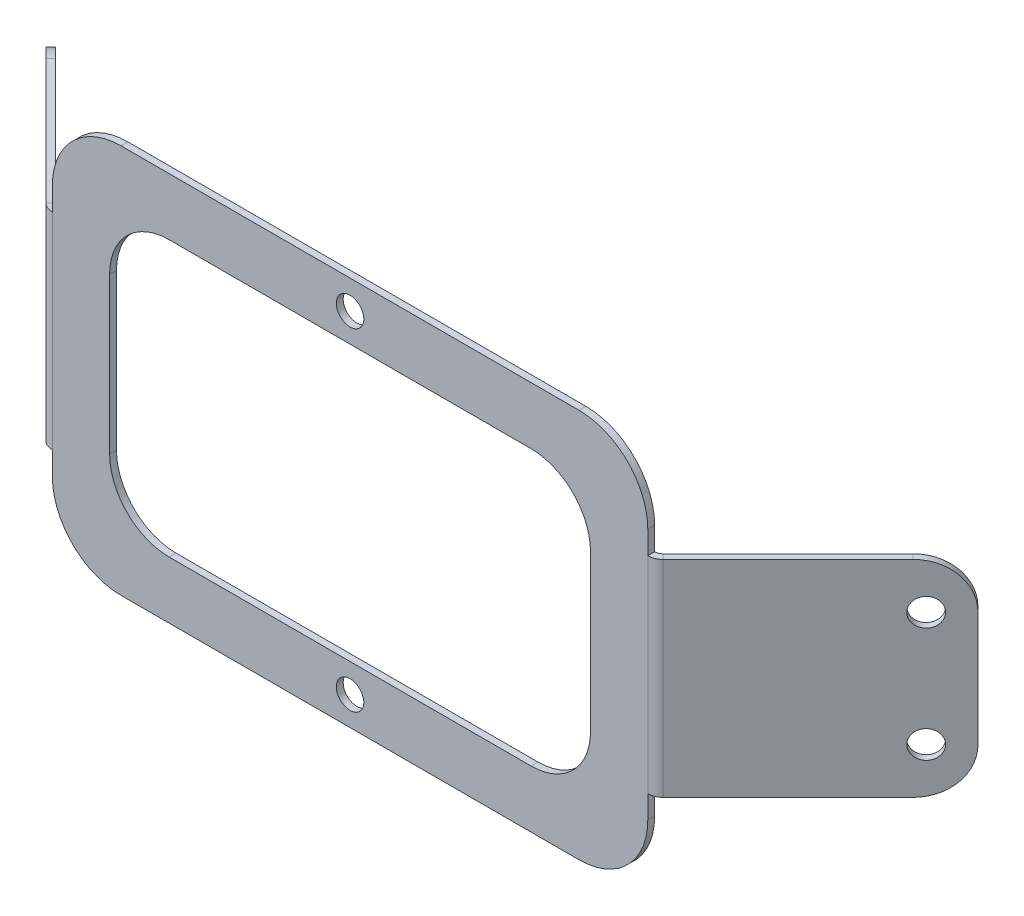
from build123d import *

# Parameters (mm, degrees)
BASE_FLANGE1_DEPTH          = 1.5
SM_EDGE_FLANGE_1_DEPTH      = 45
SM_EDGE_FLANGE_1_BEND_DEPTH = 45
SKETCH12_R                  = 3
CUT_EXTRUDE1_DEPTH          = 10
FILLET1_R                   = 10
SKETCH13_R                  = 3
CUT_EXTRUDE2_DEPTH          = 10
SKETCH14_R                  = 3
CUT_EXTRUDE3_DEPTH          = 10


# Sheet-metal steps are written as plain solids
with BuildPart() as part:
    # Sketch1 → Base-Flange1 (new body)
    with BuildSketch(Plane.XY):
        with BuildLine():
            Line((15, 0), (115, 0))
            ThreePointArc((115, 0), (125.606601718, 4.393398282), (130, 15))
            Line((130, 15), (130, 70))
            ThreePointArc((130, 70), (125.606601718, 80.606601718), (115, 85))
            Line((115, 85), (15, 85))
            ThreePointArc((15, 85), (4.393398282, 80.606601718), (0, 70))
            Line((0, 70), (0, 15))
            ThreePointArc((0, 15), (4.393398282, 4.393398282), (15, 0))
        make_face()
        with BuildLine():
            Line((104.5, 12.5), (25.5, 12.5))
            ThreePointArc((25.5, 12.5), (16.307611845, 16.307611845), (12.5, 25.5))
            Line((12.5, 25.5), (12.5, 59.5))
            ThreePointArc((12.5, 59.5), (16.307611845, 68.692388155), (25.5, 72.5))
            Line((25.5, 72.5), (104.5, 72.5))
            ThreePointArc((104.5, 72.5), (113.692388155, 68.692388155), (117.5, 59.5))
            Line((117.5, 59.5), (117.5, 25.5))
            ThreePointArc((117.5, 25.5), (113.692388155, 16.307611845), (104.5, 12.5))
        make_face(mode=Mode.SUBTRACT)
    extrude(amount=-BASE_FLANGE1_DEPTH)

    # Ребро-кромка1 section (across the edge) → Ребро-кромка1 (add)
    with BuildSketch(Plane(origin=(-0.76629509, 20, -1.5), x_dir=(0.7071067811865438, 0, -0.7071067811865512), z_dir=(0, 1, 0))):
        with BuildLine():
            Line((-1.5, 0.76629509), (-1.5, 49.378679656))
            Line((-1.5, 49.378679656), (0, 49.378679656))
            Line((0, 49.378679656), (0, 0.76629509))
            ThreePointArc((0, 0.76629509), (0.140822865, 0.058330741), (0.541852455, -0.541852455))
            Line((0.541852455, -0.541852455), (-0.518807717, -1.602512627))
            ThreePointArc((-0.518807717, -1.602512627), (-1.244996434, -0.515694408), (-1.5, 0.76629509))
        make_face()
    extrude(amount=SM_EDGE_FLANGE_1_DEPTH)

    # Ребро-кромка1 section 2 (across the edge) → Ребро-кромка1 bend (add)
    with BuildSketch(Plane(origin=(130.76629509, 65, -1.5), x_dir=(-0.7071067811865438, 0, -0.7071067811865512), z_dir=(0, -1, 0))):
        with BuildLine():
            Line((-1.5, 0.76629509), (-1.5, 49.378679656))
            Line((-1.5, 49.378679656), (0, 49.378679656))
            Line((0, 49.378679656), (0, 0.76629509))
            ThreePointArc((0, 0.76629509), (0.140822865, 0.058330741), (0.541852455, -0.541852455))
            Line((0.541852455, -0.541852455), (-0.518807717, -1.602512627))
            ThreePointArc((-0.518807717, -1.602512627), (-1.244996434, -0.515694408), (-1.5, 0.76629509))
        make_face()
    extrude(amount=SM_EDGE_FLANGE_1_BEND_DEPTH)

    # Sketch12 → Cut-Extrude1 (cut)
    with BuildSketch(Plane(origin=(65.693807717, 0, 65.693807717), x_dir=(0.7071067811865511, 0, -0.707106781186544), z_dir=(0.707106781186544, 0, 0.7071067811865511))):
        with Locations((134.905073837, 30)):
            Circle(SKETCH12_R)
        with Locations((134.905073837, 55)):
            Circle(SKETCH12_R)
    extrude(amount=-CUT_EXTRUDE1_DEPTH, mode=Mode.SUBTRACT)

    # Fillet1
    fillet1_edges = [part.edges().sort_by_distance(p)[0] for p in [
        (-36.212624407, 20, -35.885669145),
        (-36.212624407, 65, -35.885669145),
        (166.212624407, 65, -35.885669145),
        (166.212624407, 20, -35.885669145),
    ]]
    fillet(fillet1_edges, radius=FILLET1_R)

    # Sketch13 → Cut-Extrude2 (cut)
    with BuildSketch(Plane(origin=(-0.693807717, 0, 0.693807717), x_dir=(0.7071067811865511, 0, 0.707106781186544), z_dir=(-0.707106781186544, 0, 0.7071067811865511))):
        with Locations((-42.981192283, 30)):
            Circle(SKETCH13_R)
        with Locations((-42.981192283, 55)):
            Circle(SKETCH13_R)
    extrude(amount=-CUT_EXTRUDE2_DEPTH, mode=Mode.SUBTRACT)

    # Sketch14 → Cut-Extrude3 (cut)
    with BuildSketch(Plane(origin=(0, 0, -1.5), x_dir=(-1, 0, 0), z_dir=(0, 0, -1))):
        with Locations((-65, 6.25)):
            Circle(SKETCH14_R)
        with Locations((-65, 78.75)):
            Circle(SKETCH14_R)
    extrude(amount=-CUT_EXTRUDE3_DEPTH, mode=Mode.SUBTRACT)


solid = part.part
